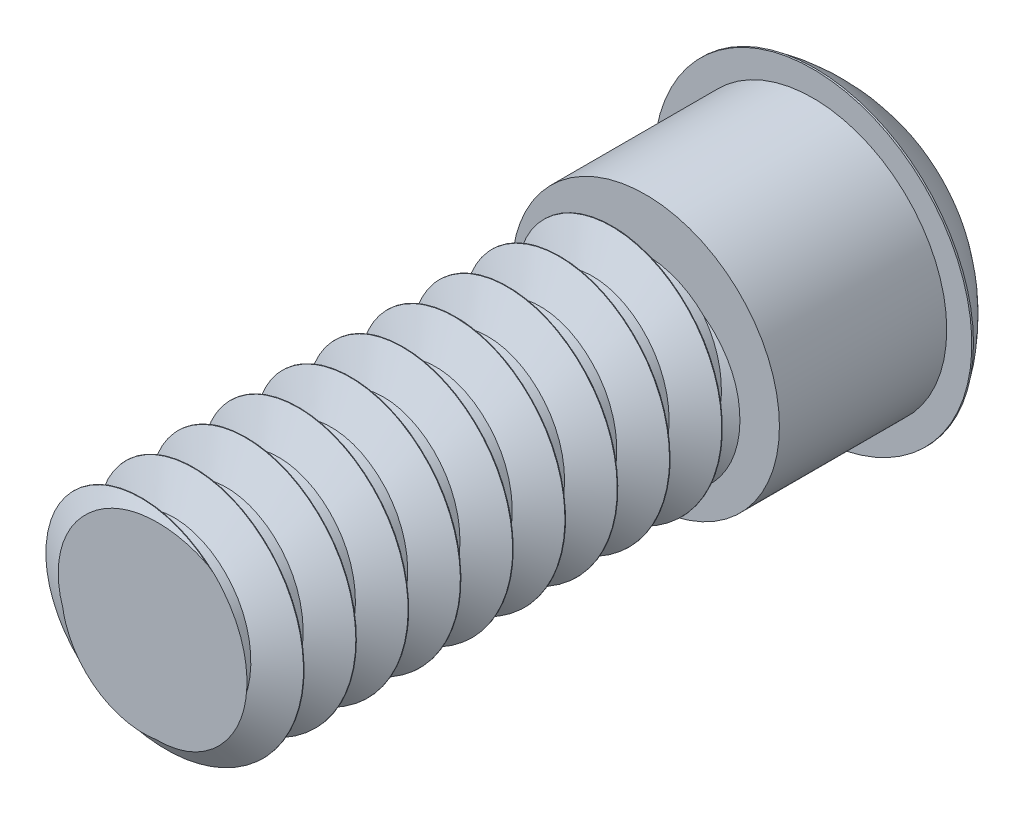
from build123d import *

# Parameters (mm, degrees)
SKETCH2_R           = 1.7526
BOSS_EXTRUDE1_DEPTH = 7.62
CUT_SWEEP1_PITCH    = 0.79375
SKETCH4_R           = 2.032
BOSS_EXTRUDE2_DEPTH = 2.54
SKETCH5_R           = 2.413
BOSS_EXTRUDE3_DEPTH = 0.0254
DOME1_FACE_RADIUS   = 2.413
DOME1_HEIGHT        = 1.27


with BuildPart() as part:
    # Sketch2 → Boss-Extrude1 (new body)
    with BuildSketch(Plane.XY):
        with Locations(Location((0, 0, 0), (0, 0, 180))):
            Circle(SKETCH2_R)
    extrude(amount=BOSS_EXTRUDE1_DEPTH)

    # Cut-Sweep1: arcs per turn and ends read off the stored shape
    # Cut-Sweep1: the profile of Sketch3 profile screwed along a left-hand helix through 23.400003 turns, 8 arcs to a turn; built about Z, then put on its axis
    cut_sweep1_z = Axis((0, 0, 0), (0, 0, 1))
    cut_sweep1_corners = [(1.7529, 0, -0.401064108), (1.2446, 0, -0.69453125), (1.2446, 0, -0.89296875), (1.7529, 0, -1.186435892)]
    with BuildLine(mode=Mode.PRIVATE) as cut_sweep1_profile:
        Line(cut_sweep1_corners[0], cut_sweep1_corners[1])
        Line(cut_sweep1_corners[1], cut_sweep1_corners[2])
        Line(cut_sweep1_corners[2], cut_sweep1_corners[3])
        Line(cut_sweep1_corners[3], cut_sweep1_corners[0])
    cut_sweep1_cap = Face(cut_sweep1_profile.wire())
    cut_sweep1_turn_angles = [0, -22.5, -45, -67.5, -90, -112.5, -135, -157.5, -180, -202.5, -225, -247.5, -270, -292.5, -315, -337.5, -360]
    cut_sweep1_turn_weights = [1, 0.9238795325112867, 1, 0.9238795325112867, 1, 0.9238795325112867, 1, 0.9238795325112867, 1, 0.9238795325112867, 1, 0.9238795325112867, 1, 0.9238795325112867, 1, 0.9238795325112867, 1]
    cut_sweep1_turn_rails = [Edge.make_bspline([Vector(p[0], p[1], 0).rotate(cut_sweep1_z, cut_sweep1_turn_angles[k]) / cut_sweep1_turn_weights[k] + Vector(0, 0, p[2] + -CUT_SWEEP1_PITCH * cut_sweep1_turn_angles[k] / 360) for k in range(17)], [0, 0, 0, 1, 1, 2, 2, 3, 3, 4, 4, 5, 5, 6, 6, 7, 7, 8, 8, 8], 2, cut_sweep1_turn_weights) for p in cut_sweep1_corners]
    cut_sweep1_turn_sides = [Face.make_surface_from_curves(cut_sweep1_turn_rails[p[0]], cut_sweep1_turn_rails[p[1]]) for p in [(0, 1), (1, 2), (2, 3), (3, 0)]]
    cut_sweep1_last_angles = [-8280, -8302.5, -8325, -8347.5, -8370, -8392.5, -8415, -8419.5005, -8424.001]
    cut_sweep1_last_weights = [1, 0.9238795325112867, 1, 0.9238795325112867, 1, 0.9238795325112867, 1, 0.9969166490103938, 1]
    cut_sweep1_last_rails = [Edge.make_bspline([Vector(p[0], p[1], 0).rotate(cut_sweep1_z, cut_sweep1_last_angles[k]) / cut_sweep1_last_weights[k] + Vector(0, 0, p[2] + -CUT_SWEEP1_PITCH * cut_sweep1_last_angles[k] / 360) for k in range(9)], [0, 0, 0, 1, 1, 2, 2, 3, 3, 4, 4, 4], 2, cut_sweep1_last_weights) for p in cut_sweep1_corners]
    cut_sweep1_last_sides = [Face.make_surface_from_curves(cut_sweep1_last_rails[p[0]], cut_sweep1_last_rails[p[1]]) for p in [(0, 1), (1, 2), (2, 3), (3, 0)]]
    cut_sweep1 = Plane(origin=(0, 0, 0), x_dir=(0, 1, 0), z_dir=(0, 0, 1)) * Solid(Shell([*[p.moved(Location((0, 0, CUT_SWEEP1_PITCH * i))) for i in range(23) for p in cut_sweep1_turn_sides], *cut_sweep1_last_sides, cut_sweep1_cap, cut_sweep1_cap.rotate(cut_sweep1_z, -8424.001).moved(Location((0, 0, -CUT_SWEEP1_PITCH * -8424.001 / 360)))]))
    add(cut_sweep1, mode=Mode.SUBTRACT)

    # Sketch4 → Boss-Extrude2 (add)
    with BuildSketch(Plane.XY):
        Circle(SKETCH4_R)
    extrude(amount=-BOSS_EXTRUDE2_DEPTH)

    # Sketch5 → Boss-Extrude3 (add)
    with BuildSketch(Plane(origin=(0, 0, -2.54), x_dir=(-1, 0, 0), z_dir=(0, 0, -1))):
        Circle(SKETCH5_R)
    extrude(amount=BOSS_EXTRUDE3_DEPTH)

    # Dome1: a dome of height H over a round flat face of radius A is a cap of a sphere of radius (A * A + H * H) / (2 * H)
    dome1_r = (DOME1_FACE_RADIUS * DOME1_FACE_RADIUS + DOME1_HEIGHT * DOME1_HEIGHT) / (2 * DOME1_HEIGHT)
    dome1_base = Plane((0, 0, -2.5654), z_dir=(0, 0, -1))
    with Locations(dome1_base.offset(DOME1_HEIGHT - dome1_r)):
        dome1_ball = Sphere(dome1_r, mode=Mode.PRIVATE)
    add(split(dome1_ball, bisect_by=dome1_base, keep=Keep.TOP, mode=Mode.PRIVATE))


solid = part.part
